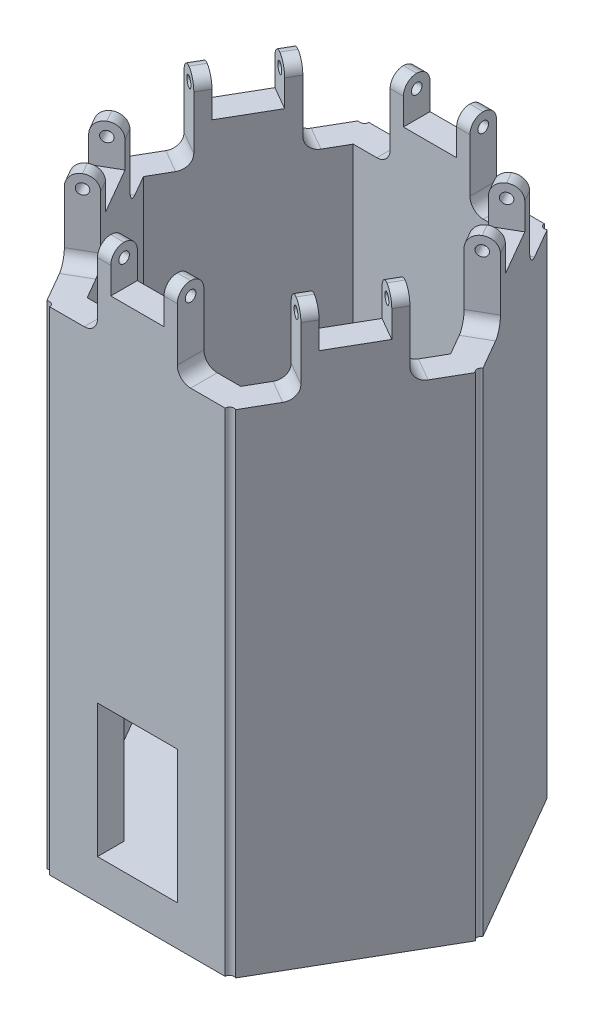
from build123d import *

# Parameters (mm, degrees)
BOSS_EXTRUDE1_DEPTH                 = 15
BOSS_EXTRUDE3_DEPTH                 = 170
SKETCH5_W                           = 30
SKETCH5_H                           = 10
BOSS_EXTRUDE4_DEPTH                 = 30
CIRPATTERN2_COUNT                   = 6
CUT_EXTRUDE1_REACH                  = 264.726
SKETCH7_W                           = 20
SKETCH7_H                           = 15
CIRPATTERN4_COUNT                   = 6
FILLET1_R                           = 5
F_4_0_MM_DOWEL_HOLES1_D             = 4
CIRPATTERN8_COUNT                   = 6
CUT_EXTRUDE2_REACH                  = 257.783
SKETCH11_W                          = 30
SKETCH11_H                          = 50
M3_CLEARANCE_HOLE1_D                = 3.6
LPATTERN1_COUNT                     = 2
LPATTERN1_PITCH                     = 31.04
LPATTERN1_COUNT_DIR2                = 2
LPATTERN1_PITCH_DIR2                = 31.04
TAP_DRILL_FOR_M4X0_7_TAP2_OUTLINE_R = 1.65
TAP_DRILL_FOR_M4X0_7_TAP2_DEPTH     = 185


# Read off the part's stored shape, not the designer's step: Tap Drill for M4x0.7 Tap2
with BuildPart() as part:
    # Sketch1 → Boss-Extrude1 (new body)
    with BuildSketch(Plane(origin=(0, 0, 0), x_dir=(1, 0, 0), z_dir=(0, 1, 0))):
        Polygon((-69.282032303, 0), (-34.641016151, 60), (34.641016151, 60), (69.282032303, 0), (34.641016151, -60), (-34.641016151, -60), align=None)
    extrude(amount=BOSS_EXTRUDE1_DEPTH)

    # Sketch4 → Boss-Extrude3 (add)
    with BuildSketch(Plane(origin=(0, 15, 0), x_dir=(1, 0, 0), z_dir=(0, 1, 0))):
        Polygon((-34.641016151, -60), (34.641016151, -60), (69.282032303, 0), (57.735026919, 0), (28.867513459, -50), (-28.867513459, -50), (-57.735026919, 0), (-69.282032303, 0), align=None)
    boss_extrude3 = extrude(amount=BOSS_EXTRUDE3_DEPTH)

    # Mirror1: Boss-Extrude3 across plane
    add(boss_extrude3.mirror(Plane(origin=(57.735026919, 185, 0), x_dir=(1, 0, 0), z_dir=(0, 0, 1))))

    # Sketch5 → Boss-Extrude4 (add)
    with BuildSketch(Plane(origin=(0, 185, 0), x_dir=(1, 0, 0), z_dir=(0, 1, 0))):
        with Locations((0, -55)):
            Rectangle(SKETCH5_W, SKETCH5_H)
    boss_extrude4 = extrude(amount=BOSS_EXTRUDE4_DEPTH)

    # CirPattern2: Boss-Extrude4 ×6 about axis
    cirpattern2_axis = Axis((0, 0, 0), (0, 1, 0))
    for i in range(1, CIRPATTERN2_COUNT):
        add(boss_extrude4.rotate(cirpattern2_axis, i * 360 / CIRPATTERN2_COUNT))

    # Sketch7 → Cut-Extrude1 (cut, up to next)
    with BuildSketch(Plane(origin=(-51.961524227, 0, 30), x_dir=(0.49999999999999695, 0, 0.8660254037844404), z_dir=(-0.8660254037844404, 0, 0.49999999999999695)), mode=Mode.PRIVATE) as cut_extrude1_sk1:
        with Locations((0, 207.5)):
            Rectangle(SKETCH7_W, SKETCH7_H)
    cut_extrude1_tool1 = extrude(cut_extrude1_sk1.sketch, amount=-CUT_EXTRUDE1_REACH, mode=Mode.PRIVATE) & part.part
    cut_extrude1 = cut_extrude1_tool1.solids().sort_by_distance((-51.961524, 207.5, 30))[0]
    add(cut_extrude1, mode=Mode.SUBTRACT)

    # CirPattern4: Cut-Extrude1 ×6 about axis
    cirpattern4_axis = Axis((0, 0, 0), (0, 1, 0))
    for i in range(1, CIRPATTERN4_COUNT):
        add(cut_extrude1.rotate(cirpattern4_axis, i * 360 / CIRPATTERN4_COUNT), mode=Mode.SUBTRACT)

    # Fillet1
    fillet1_edges = [part.edges().sort_by_distance(p)[0] for p in [
        (-55.131397208, 185, 14.509618943),
        (-40.131397208, 185, 40.490381057),
        (-40.131397208, 185, -40.490381057),
        (-55.131397208, 185, -14.509618943),
        (15, 185, -55),
        (-15, 185, -55),
        (55.131397208, 185, -14.509618943),
        (40.131397208, 185, -40.490381057),
        (40.131397208, 185, 40.490381057),
        (55.131397208, 185, 14.509618943),
        (-15, 185, 55),
        (15, 185, 55),
    ]]
    fillet(fillet1_edges, radius=FILLET1_R)
    fillet1_2_edges = [part.edges().sort_by_distance(p)[0] for p in [
        (-49.551270189, 215, 14.174682453),
        (-58.211524227, 215, 19.174682453),
        (-37.051270189, 215, -35.825317547),
        (-45.711524227, 215, -40.825317547),
        (12.5, 215, -50),
        (12.5, 215, -60),
        (49.551270189, 215, -14.174682453),
        (58.211524227, 215, -19.174682453),
        (37.051270189, 215, 35.825317547),
        (45.711524227, 215, 40.825317547),
        (-37.051270189, 215, 35.825317547),
        (-45.711524227, 215, 40.825317547),
        (49.551270189, 215, 14.174682453),
        (58.211524227, 215, 19.174682453),
        (-49.551270189, 215, -14.174682453),
        (-58.211524227, 215, -19.174682453),
        (-12.5, 215, -50),
        (-12.5, 215, -60),
        (37.051270189, 215, -35.825317547),
        (45.711524227, 215, -40.825317547),
        (12.5, 215, 50),
        (12.5, 215, 60),
        (-12.5, 215, 50),
        (-12.5, 215, 60),
    ]]
    fillet(fillet1_2_edges, radius=FILLET1_R - 0.0001)  # a hair under: the kernel refuses the full size

    # Ø4.0 mm Dowel Holes1 (through all)
    with Locations(Plane(origin=(15, 0, 0), x_dir=(0, 0, -1), z_dir=(1, 0, 0))):
        with Locations((-55, 210)):
            f_4_0_mm_dowel_holes1 = Hole(F_4_0_MM_DOWEL_HOLES1_D / 2)

    # CirPattern8: Ø4.0 mm Dowel Holes1 ×6 about axis
    cirpattern8_axis = Axis((0, 15, 0), (0, -1, 0))
    for i in range(1, CIRPATTERN8_COUNT):
        add(f_4_0_mm_dowel_holes1.rotate(cirpattern8_axis, i * 360 / CIRPATTERN8_COUNT), mode=Mode.SUBTRACT)

    # Sketch11 → Cut-Extrude2 (cut, up to next)
    with BuildSketch(Plane.XY.offset(60), mode=Mode.PRIVATE) as cut_extrude2_sk1:
        with Locations((0, 40)):
            Rectangle(SKETCH11_W, SKETCH11_H)
    cut_extrude2_tool1 = extrude(cut_extrude2_sk1.sketch, amount=-CUT_EXTRUDE2_REACH, mode=Mode.PRIVATE) & part.part
    add(cut_extrude2_tool1.solids().sort_by_distance((0, 40, 60))[0], mode=Mode.SUBTRACT)

    # M3 Clearance Hole1 (through all)
    with Locations(Plane(origin=(0, 0, 0), x_dir=(-1, 0, 0), z_dir=(0, -1, 0))):
        with Locations((-15.52, 15.52)):
            m3_clearance_hole1 = Hole(M3_CLEARANCE_HOLE1_D / 2)

    # LPattern1: M3 Clearance Hole1 2 × 2
    with Locations(*[(-i * LPATTERN1_PITCH, 0, j * LPATTERN1_PITCH_DIR2) for i in range(LPATTERN1_COUNT) for j in range(LPATTERN1_COUNT_DIR2) if (i, j) != (0, 0)]):
        add(m3_clearance_hole1, mode=Mode.SUBTRACT)

    # Tap Drill for M4x0.7 Tap2 outline → Tap Drill for M4x0.7 Tap2 (cut)
    with BuildSketch(Plane(origin=(0, 0, 0), x_dir=(1, 0, 0), z_dir=(0, 1, 0))):
        Circle(TAP_DRILL_FOR_M4X0_7_TAP2_OUTLINE_R)
        with Locations((-21.213203436, -21.213203436)):
            Circle(TAP_DRILL_FOR_M4X0_7_TAP2_OUTLINE_R)
        with Locations((-30, 0)):
            Circle(TAP_DRILL_FOR_M4X0_7_TAP2_OUTLINE_R)
        with Locations((-21.213203436, 21.213203436)):
            Circle(TAP_DRILL_FOR_M4X0_7_TAP2_OUTLINE_R)
        with Locations((0, 30)):
            Circle(TAP_DRILL_FOR_M4X0_7_TAP2_OUTLINE_R)
        with Locations((21.213203436, 21.213203436)):
            Circle(TAP_DRILL_FOR_M4X0_7_TAP2_OUTLINE_R)
        with Locations((30, 0)):
            Circle(TAP_DRILL_FOR_M4X0_7_TAP2_OUTLINE_R)
        with Locations((21.213203436, -21.213203436)):
            Circle(TAP_DRILL_FOR_M4X0_7_TAP2_OUTLINE_R)
        with Locations((0, -30)):
            Circle(TAP_DRILL_FOR_M4X0_7_TAP2_OUTLINE_R)
        with BuildLine():
            ThreePointArc((-32.991016151, -60), (-33.816016151, -58.571058084), (-35.466016151, -58.571058084))
            Line((-35.466016151, -58.571058084), (-34.641016151, -60))
            Line((-34.641016151, -60), (-32.991016151, -60))
        make_face()
        with BuildLine():
            Line((-69.282032303, 0), (-68.457032303, -1.428941916))
            ThreePointArc((-68.457032303, -1.428941916), (-67.632032303, 0), (-68.457032303, 1.428941916))
            Line((-68.457032303, 1.428941916), (-69.282032303, 0))
        make_face()
        with BuildLine():
            ThreePointArc((35.466016151, -58.571058084), (33.816016151, -58.571058084), (32.991016151, -60))
            Line((32.991016151, -60), (34.641016151, -60))
            Line((34.641016151, -60), (35.466016151, -58.571058084))
        make_face()
        with BuildLine():
            Line((-34.641016151, 60), (-35.466016151, 58.571058084))
            ThreePointArc((-35.466016151, 58.571058084), (-33.816016151, 58.571058084), (-32.991016151, 60))
            Line((-32.991016151, 60), (-34.641016151, 60))
        make_face()
        with BuildLine():
            ThreePointArc((68.457032303, 1.428941916), (67.632032303, 0), (68.457032303, -1.428941916))
            Line((68.457032303, -1.428941916), (69.282032303, 0))
            Line((69.282032303, 0), (68.457032303, 1.428941916))
        make_face()
        with BuildLine():
            Line((34.641016151, 60), (32.991016151, 60))
            ThreePointArc((32.991016151, 60), (33.816016151, 58.571058084), (35.466016151, 58.571058084))
            Line((35.466016151, 58.571058084), (34.641016151, 60))
        make_face()
    extrude(amount=TAP_DRILL_FOR_M4X0_7_TAP2_DEPTH, mode=Mode.SUBTRACT)


solid = part.part
